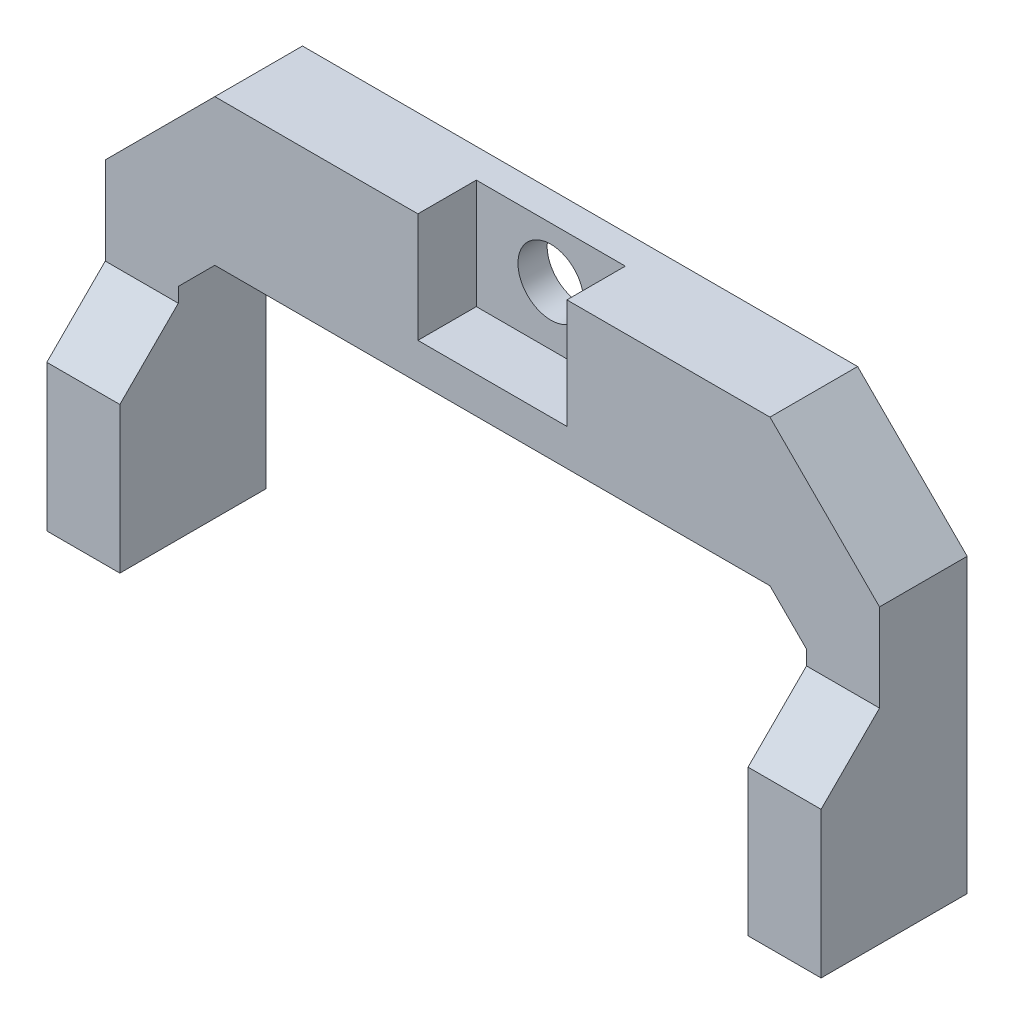
from build123d import *

# Parameters (mm, degrees)
BOSS_EXTRUDE1_DEPTH  = 6
SKETCH6_W            = 5
SKETCH6_H            = 10
BOSS_EXTRUDE2_DEPTH  = 4
SKETCH3_W            = 5.1
SKETCH3_H            = 7.5
CUT_EXTRUDE1_DEPTH   = 4
M4_CLEARANCE_HOLE1_D = 4.5
CHAMFER2_SIZE        = 4


with BuildPart() as part:
    # Sketch1 → Boss-Extrude1 (new body)
    with BuildSketch(Plane.XY):
        Polygon((0, 0), (0, -10), (-19, -10), (-21.5, -12.5), (-21.5, -27.5), (-26.5, -27.5), (-26.5, -7.5), (-19, 0), align=None)
    boss_extrude1 = extrude(amount=BOSS_EXTRUDE1_DEPTH)

    # Sketch6 → Boss-Extrude2 (add)
    with BuildSketch(Plane.XY.offset(6)):
        with Locations((-24, -22.5)):
            Rectangle(SKETCH6_W, SKETCH6_H)
    boss_extrude2 = extrude(amount=BOSS_EXTRUDE2_DEPTH)

    # Sketch3 → Cut-Extrude1 (cut)
    with BuildSketch(Plane.XY.offset(6)):
        with Locations((-2.55, -3.75)):
            Rectangle(SKETCH3_W, SKETCH3_H)
    cut_extrude1 = extrude(amount=-CUT_EXTRUDE1_DEPTH, mode=Mode.SUBTRACT)

    # Mirror1: Boss-Extrude1, Boss-Extrude2, Cut-Extrude1 across plane
    add(boss_extrude1.mirror(Plane(origin=(0, 0, 6), x_dir=(0, 0, 1), z_dir=(-1, 0, 0))))
    add(boss_extrude2.mirror(Plane(origin=(0, 0, 6), x_dir=(0, 0, 1), z_dir=(-1, 0, 0))))
    add(cut_extrude1.mirror(Plane(origin=(0, 0, 6), x_dir=(0, 0, 1), z_dir=(-1, 0, 0))), mode=Mode.SUBTRACT)

    # M4 Clearance Hole1 (through all)
    with Locations(Plane.XY.offset(2)):
        with Locations((0, -3.5)):
            Hole(M4_CLEARANCE_HOLE1_D / 2)

    # Chamfer2
    # the kernel refuses this chamfer: 4 mm, written as the material it adds along each edge
    with BuildSketch(Plane(origin=(-21.5, -17.5, 6), x_dir=(0, 0.9996219169112968, -0.02749587661058627), z_dir=(-1, 0, 0))) as chamfer2_piece_1_section:
        Polygon((CHAMFER2_SIZE * 0.999621916911, -CHAMFER2_SIZE * 0.0274958766106), (-CHAMFER2_SIZE * 0.0274958766106, -CHAMFER2_SIZE * 0.999621916911), (0, 0), align=None)
    chamfer2_piece_1 = extrude(amount=5, mode=Mode.PRIVATE)
    chamfer2_piece_1 = split(chamfer2_piece_1, bisect_by=Plane(origin=(-24, -16.178383383, 10), z_dir=(0, 0, -1)), keep=Keep.TOP, mode=Mode.PRIVATE)
    add(chamfer2_piece_1)
    with BuildSketch(Plane(origin=(21.5, -17.5, 6), x_dir=(0, 0.9996219169112968, -0.02749587661058627), z_dir=(1, 0, 0))) as chamfer2_piece_2_section:
        Polygon((CHAMFER2_SIZE * 0.999621916911, CHAMFER2_SIZE * 0.0274958766106), (-CHAMFER2_SIZE * 0.0274958766106, CHAMFER2_SIZE * 0.999621916911), (0, 0), align=None)
    chamfer2_piece_2 = extrude(amount=5, mode=Mode.PRIVATE)
    chamfer2_piece_2 = split(chamfer2_piece_2, bisect_by=Plane(origin=(24, -16.178383383, 10), z_dir=(0, 0, -1)), keep=Keep.TOP, mode=Mode.PRIVATE)
    add(chamfer2_piece_2)


solid = part.part
